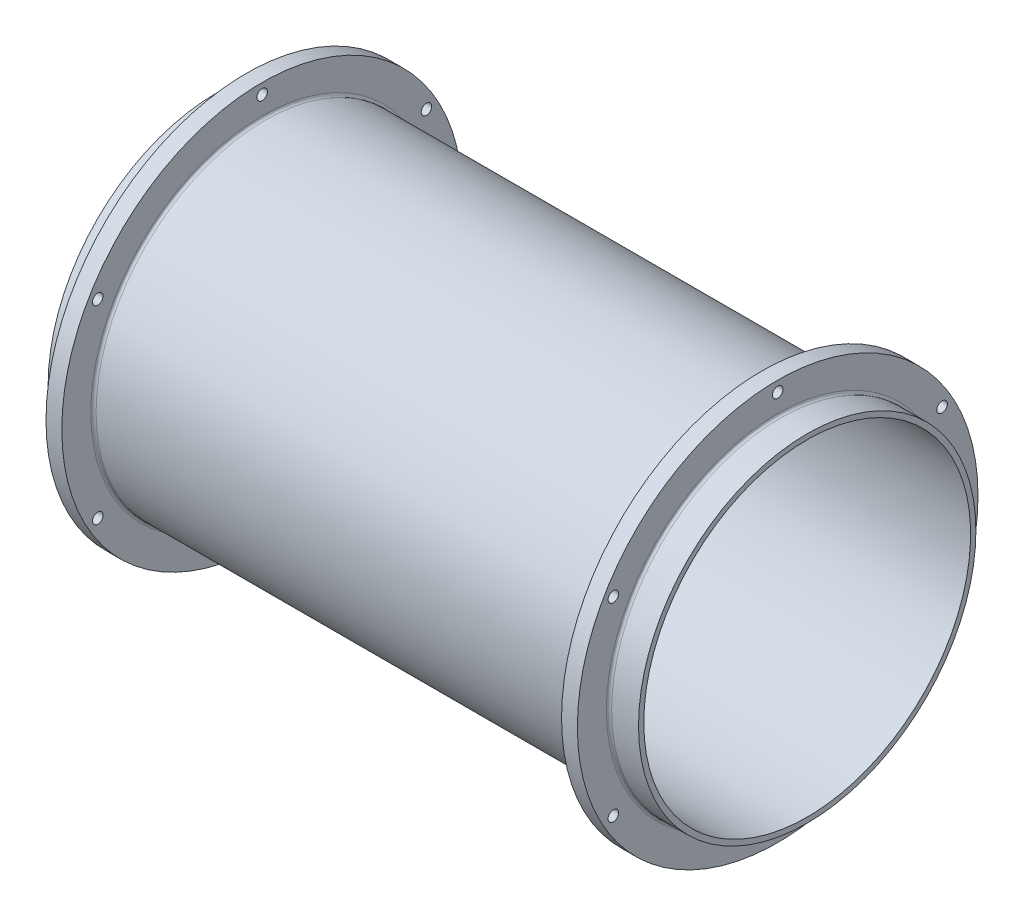
from build123d import *

# Parameters (mm, degrees)
SKETCH2_R          = 3.175
CUT_EXTRUDE1_DEPTH = 379.464261721


with BuildPart() as part:
    # Sketch1 → Revolve1 (revolve)
    with BuildSketch(Plane.XY, mode=Mode.PRIVATE) as revolve1_sk:
        Polygon((160.02, -101.6), (177.8, -101.6), (177.8, -98.425), (-177.8, -98.425), (-177.8, -101.6), (-160.02, -101.6), (-160.02, -120.65), (-150.495, -120.65), (-150.495, -101.6), (150.495, -101.6), (150.495, -120.65), (160.02, -120.65), align=None)
        Polygon((177.8, 98.425), (177.8, 101.6), (160.02, 101.6), (160.02, 120.65), (150.495, 120.65), (150.495, 101.6), (-150.495, 101.6), (-150.495, 120.65), (-160.02, 120.65), (-160.02, 101.6), (-177.8, 101.6), (-177.8, 98.425), align=None)
    revolve(revolve1_sk.sketch.rotate(Axis((0, 0, 0), (1, 0, 0)), 270), axis=Axis((0, 0, 0), (1, 0, 0)))

    # Sketch2 → Cut-Extrude1 (cut, through all)
    with BuildSketch(Plane(origin=(160.02, 0, 0), x_dir=(0, 0, -1), z_dir=(1, 0, 0))):
        with Locations(Location((0, 114.3, 0), (0, 0, 180))):
            Circle(SKETCH2_R)
        with Locations(Location((98.986703653, 57.15, 0), (0, 0, 180))):
            Circle(SKETCH2_R)
        with Locations(Location((98.986703653, -57.15, 0), (0, 0, 180))):
            Circle(SKETCH2_R)
        with Locations(Location((0, -114.3, 0), (0, 0, 180))):
            Circle(SKETCH2_R)
        with Locations(Location((-98.986703653, -57.15, 0), (0, 0, 180))):
            Circle(SKETCH2_R)
        with Locations(Location((-98.986703653, 57.15, 0), (0, 0, 180))):
            Circle(SKETCH2_R)
    extrude(amount=-CUT_EXTRUDE1_DEPTH, mode=Mode.SUBTRACT)

    # Solvent Weld: read off the stored shape, not the designer's step
    # Solvent Weld outline → Solvent Weld (revolve)
    with BuildSketch(Plane.YX):
        with BuildLine():
            Line((101.6, 160.02), (103.1875, 160.02))
            ThreePointArc((103.1875, 160.02), (102.064967985, 160.484967985), (101.6, 161.6075))
            Line((101.6, 161.6075), (101.6, 160.02))
        make_face()
        with BuildLine():
            ThreePointArc((101.6, 148.9075), (102.064967985, 150.030032015), (103.1875, 150.495))
            Line((103.1875, 150.495), (101.6, 150.495))
            Line((101.6, 150.495), (101.6, 148.9075))
        make_face()
        with BuildLine():
            ThreePointArc((103.1875, -150.495), (102.064967985, -150.030032015), (101.6, -148.9075))
            Line((101.6, -148.9075), (101.6, -150.495))
            Line((101.6, -150.495), (103.1875, -150.495))
        make_face()
        with BuildLine():
            ThreePointArc((101.6, -161.6075), (102.064967985, -160.484967985), (103.1875, -160.02))
            Line((103.1875, -160.02), (101.6, -160.02))
            Line((101.6, -160.02), (101.6, -161.6075))
        make_face()
    revolve(axis=Axis((0, 0, 0), (1, 0, 0)))


solid = part.part
